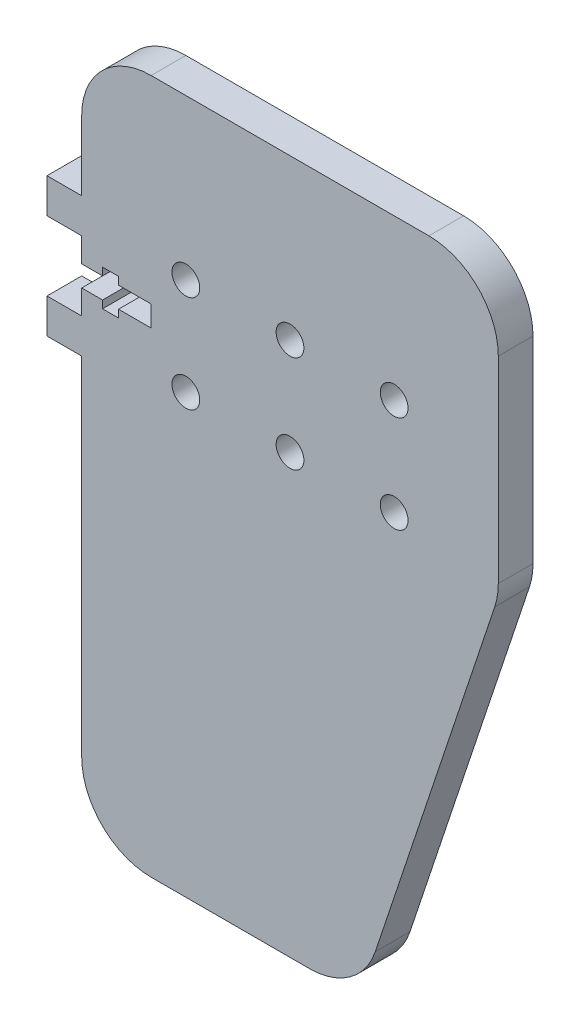
from build123d import *

# Parameters (mm, degrees)
ESQUISSE1_R        = 2
BOSS_EXTRU_1_DEPTH = 5
CONG_1_R           = 10


with BuildPart() as part:
    # Esquisse1 → Boss.-Extru.1 (new body)
    with BuildSketch(Plane.XY):
        Polygon((0, 100), (0, 80), (-5, 80), (-5, 75), (0, 75), (0, 71.5), (3, 71.5), (3, 72.6), (5.3, 72.6), (5.3, 71.5), (10, 71.5), (10, 68.5), (5.3, 68.5), (5.3, 67.4), (3, 67.4), (3, 68.5), (0, 68.5), (0, 65), (-5, 65), (-5, 60), (0, 60), (0, 0), (40, 0), (60, 60), (60, 100), align=None)
        with Locations((15, 63)):
            Circle(ESQUISSE1_R, mode=Mode.SUBTRACT)
        with Locations((15, 77)):
            Circle(ESQUISSE1_R, mode=Mode.SUBTRACT)
        with Locations((30, 63)):
            Circle(ESQUISSE1_R, mode=Mode.SUBTRACT)
        with Locations((45, 63)):
            Circle(ESQUISSE1_R, mode=Mode.SUBTRACT)
        with Locations((30, 77)):
            Circle(ESQUISSE1_R, mode=Mode.SUBTRACT)
        with Locations((45, 77)):
            Circle(ESQUISSE1_R, mode=Mode.SUBTRACT)
    extrude(amount=BOSS_EXTRU_1_DEPTH)

    # Congé1
    cong_1_edges = [part.edges().sort_by_distance(p)[0] for p in [
        (0, 100, 2.5),
        (60, 100, 2.5),
        (60, 60, 2.5),
        (0, 0, 2.5),
        (40, 0, 2.5),
    ]]
    fillet(cong_1_edges, radius=CONG_1_R)


solid = part.part
